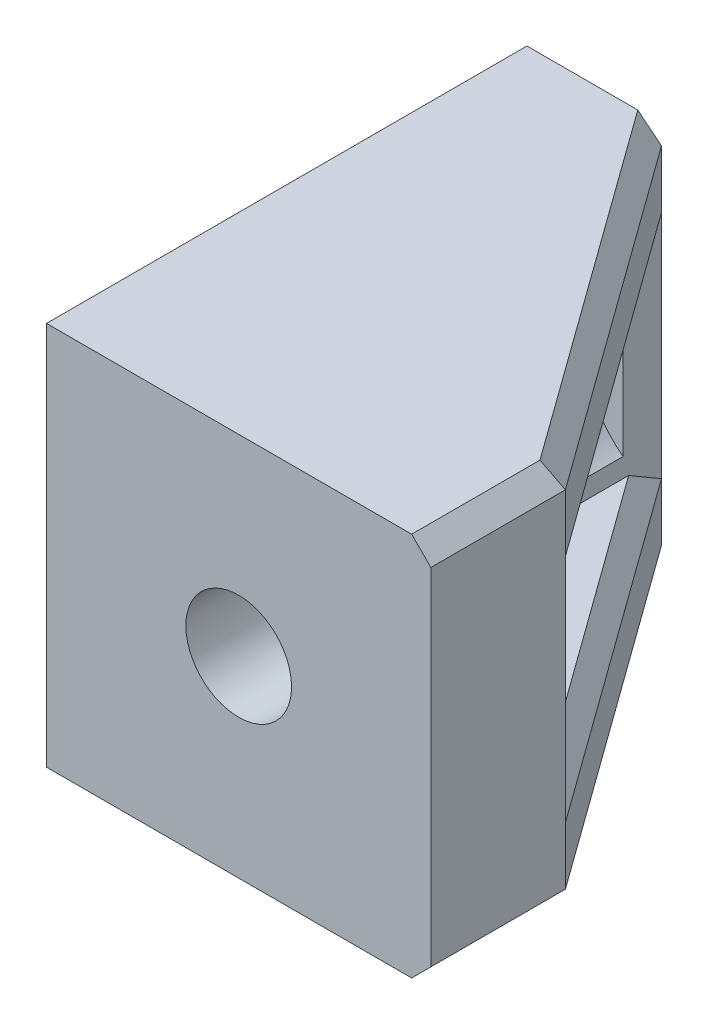
from build123d import *

# Parameters (mm, degrees)
MAIN_DEPTH         = 20
SKETCH3_R          = 2.25
SCREW_HOLE_DEPTH   = 459.547512827
SKETCH4_R          = 2.75
SCREW_HOLE_2_DEPTH = 461.247257207
SCREW_CUT_R        = 5
SCREWCUT_DEPTH     = 16
CUT_EXTRUDE7_START = -5
SKETCH7_R          = 4
CUT_EXTRUDE7_DEPTH = 5
RIB3_REACH         = 57.989
SKETCH8_WALL_W     = 136.182475206
SKETCH8_WALL_H     = 5
RIB4_REACH         = 57.989
SKETCH9_WALL_W     = 136.182475206
SKETCH9_WALL_H     = 5
CHAMFER1_SIZE      = 1


with BuildPart() as part:
    # Sketch2 → main (new body)
    with BuildSketch(Plane(origin=(0, -457.638253618, -1.412254138), x_dir=(1, 0, 0), z_dir=(0, 1, 0))):
        Polygon((25.505676484, -2.181428465), (32.505676484, -2.181428465), (32.505676484, -20.181428465), (45.505676484, -20.181428465), (45.505676484, -27.181428465), (25.505676484, -27.181428465), align=None)
    extrude(amount=MAIN_DEPTH)

    # Sketch3 → screw_hole (cut, through all)
    with BuildSketch(Plane(origin=(32.505676484, 0, 0), x_dir=(0, 0, -1), z_dir=(1, 0, 0))):
        with Locations((-6.769174326, -447.638253618)):
            Circle(SKETCH3_R)
    extrude(amount=-SCREW_HOLE_DEPTH, mode=Mode.SUBTRACT)

    # Sketch4 → screw_hole_2 (cut, through all)
    with BuildSketch(Plane(origin=(0, 0, 18.769174326), x_dir=(-1, 0, 0), z_dir=(0, 0, -1))):
        with Locations((-35.505676484, -447.638253618)):
            Circle(SKETCH4_R)
    extrude(amount=-SCREW_HOLE_2_DEPTH, mode=Mode.SUBTRACT)

    # screw_cut → screwcut (cut)
    with BuildSketch(Plane(origin=(0, 0, 18.769174326), x_dir=(-1, 0, 0), z_dir=(0, 0, -1))):
        with Locations((-35.505676484, -447.638253618)):
            Circle(SCREW_CUT_R)
    extrude(amount=SCREWCUT_DEPTH, mode=Mode.SUBTRACT)

    # Sketch7 → Cut-Extrude7 (cut)
    with BuildSketch(Plane.ZY.offset(-25.505676484).offset(CUT_EXTRUDE7_START)):
        with Locations((6.769174326, -447.638253618)):
            Circle(SKETCH7_R)
    extrude(amount=-CUT_EXTRUDE7_DEPTH, mode=Mode.SUBTRACT)

    # Sketch8 wall → Rib3 (add, up to next)
    with BuildSketch(Plane(origin=(39.005676484, -457.638253618, 9.769174326), x_dir=(0.585490553844, 0, 0.8106792284), z_dir=(-0.8106792284, 0, 0.585490553844)), mode=Mode.PRIVATE) as rib3_sk1:
        with Locations((0, 2.5)):
            Rectangle(SKETCH8_WALL_W, SKETCH8_WALL_H)
    rib3_tool1 = extrude(rib3_sk1.sketch, amount=RIB3_REACH, mode=Mode.PRIVATE) - part.part
    add(rib3_tool1.solids().sort_by_distance((39.005676484, -457.638253618, 9.769174326))[0])

    # Sketch9 wall → Rib4 (add, up to next)
    with BuildSketch(Plane(origin=(39.005676484, -437.638253618, 9.769174326), x_dir=(0.585490553844, 0, 0.8106792284), z_dir=(0.8106792284, 0, -0.585490553844)), mode=Mode.PRIVATE) as rib4_sk1:
        with Locations((0, 2.5)):
            Rectangle(SKETCH9_WALL_W, SKETCH9_WALL_H)
    rib4_tool1 = extrude(rib4_sk1.sketch, amount=-RIB4_REACH, mode=Mode.PRIVATE) - part.part
    add(rib4_tool1.solids().sort_by_distance((39.005676484, -437.638253618, 9.769174326))[0])

    # Chamfer1
    chamfer1_edges = [part.edges().sort_by_distance(p)[0] for p in [
        (39.005676484, -437.638253618, 9.769174326),
        (45.505676484, -437.638253618, 22.269174326),
        (39.005676484, -457.638253618, 9.769174326),
        (45.505676484, -457.638253618, 22.269174326),
        (39.005676484, -452.638253618, 9.769174326),
        (39.005676484, -442.638253618, 9.769174326),
    ]]
    chamfer(chamfer1_edges, length=CHAMFER1_SIZE)


solid = part.part
